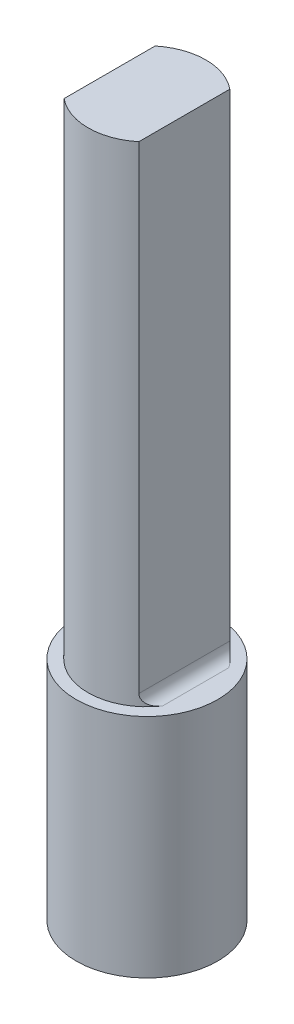
from build123d import *

# Parameters (mm, degrees)
SKETCH1_R           = 3.125
BOSS_EXTRUDE1_DEPTH = 5
BOSS_EXTRUDE2_DEPTH = 21.6
FILLET1_R           = 0.5


with BuildPart() as part:
    # Sketch1 → Boss-Extrude1 (new, symmetric)
    with BuildSketch(Plane(origin=(0, 0, 0), x_dir=(1, 0, 0), z_dir=(0, 1, 0))):
        Circle(SKETCH1_R)
    extrude(amount=BOSS_EXTRUDE1_DEPTH, both=True)

    # Sketch2 → Boss-Extrude2 (add)
    with BuildSketch(Plane(origin=(0, 5, 0), x_dir=(1, 0, 0), z_dir=(0, 1, 0))):
        with BuildLine():
            Line((-1.65, -2.00935313), (-1.65, 2.00935313))
            ThreePointArc((-1.65, 2.00935313), (0, 2.6), (1.65, 2.00935313))
            Line((1.65, 2.00935313), (1.65, -2.00935313))
            ThreePointArc((1.65, -2.00935313), (0, -2.6), (-1.65, -2.00935313))
        make_face()
    extrude(amount=BOSS_EXTRUDE2_DEPTH)

    # Fillet1
    fillet1_edges = [part.edges().sort_by_distance(p)[0] for p in [
        (1.65, 5, 0),
        (-1.65, 5, 0),
    ]]
    fillet(fillet1_edges, radius=FILLET1_R)


solid = part.part
